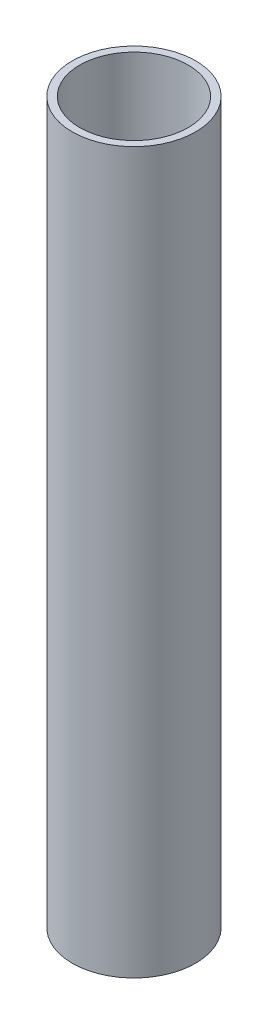
from build123d import *

# Parameters (mm, degrees)
SKETCH1_R           = 1.25
SKETCH1_R_2         = 1.1
BOSS_EXTRUDE1_DEPTH = 14.6


with BuildPart() as part:
    # Sketch1 → Boss-Extrude1 (new body)
    with BuildSketch(Plane(origin=(0, 0, 0), x_dir=(1, 0, 0), z_dir=(0, 1, 0))):
        Circle(SKETCH1_R)
        Circle(SKETCH1_R_2, mode=Mode.SUBTRACT)
    extrude(amount=BOSS_EXTRUDE1_DEPTH)


solid = part.part
